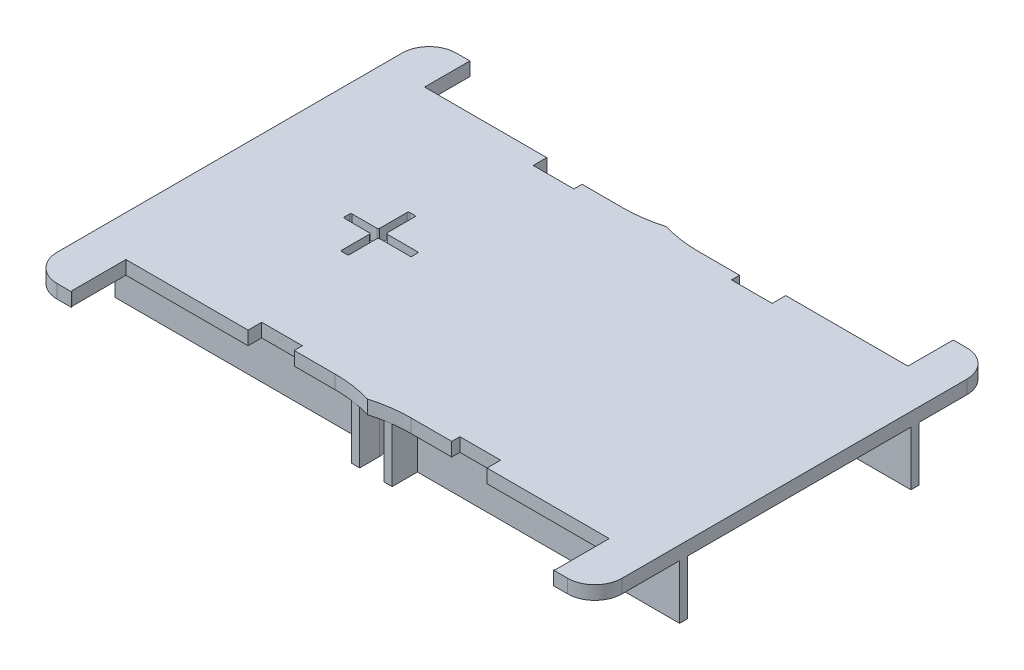
from build123d import *

# Parameters (mm, degrees)
SKETCH1_W            = 208
SKETCH1_H            = 147
BOSS_EXTRUDE1_DEPTH  = 5
CUT_EXTRUDE1_DEPTH   = 129.501744983
SKETCH3_W            = 88.802487793
SKETCH3_H            = 5
CUT_EXTRUDE2_DEPTH   = 5
MIRROR3_COPY_1_DEPTH = 129.501744983
FILLET1_R            = 10
CUT_EXTRUDE3_DEPTH   = 129.501744983
BOSS_EXTRUDE2_DEPTH  = 20
FILLET2_R            = 5
FILLET2_OF_MIRROR4_R = 5
MIRROR5_START        = -20
MIRROR5_DEPTH        = 20


# Read off the part's stored shape, not the designer's step: Mirror5
with BuildPart() as part:
    # Sketch1 → Boss-Extrude1 (new body)
    with BuildSketch(Plane(origin=(0, 0, 0), x_dir=(1, 0, 0), z_dir=(0, 1, 0))):
        with Locations((0, -1.810679612)):
            Rectangle(SKETCH1_W, SKETCH1_H)
    extrude(amount=BOSS_EXTRUDE1_DEPTH)

    # Sketch2 → Cut-Extrude1 (cut, through all)
    with BuildSketch(Plane(origin=(0, 5, 0), x_dir=(1, 0, 0), z_dir=(0, 1, 0))):
        with BuildLine():
            Line((-89, 75), (-89, 55))
            Line((-89, 55), (-44, 55))
            Line((-44, 55), (-44, 50))
            Line((-44, 50), (-29, 50))
            Line((-29, 50), (-29, 53))
            Line((-29, 53), (-14, 53))
            ThreePointArc((-14, 53), (-6.928932188, 53.502525317), (0, 55))
            Line((0, 55), (0, 75))
            Line((0, 75), (-89, 75))
        make_face()
    cut_extrude1 = extrude(amount=-CUT_EXTRUDE1_DEPTH, mode=Mode.SUBTRACT)

    # Mirror1: Cut-Extrude1 across plane
    add(cut_extrude1.mirror(Plane.XY), mode=Mode.SUBTRACT)

    # Sketch3 → Cut-Extrude2 (cut)
    with BuildSketch(Plane.XY.offset(75.310679612)):
        with Locations((-44.401243897, 2.5)):
            Rectangle(SKETCH3_W, SKETCH3_H)
    cut_extrude2 = extrude(amount=-CUT_EXTRUDE2_DEPTH, mode=Mode.SUBTRACT)

    # Mirror3: Cut-Extrude1, Cut-Extrude2 across plane
    add(cut_extrude1.mirror(Plane(origin=(0, 0, 0), x_dir=(0, 0, 1), z_dir=(1, 0, 0))), mode=Mode.SUBTRACT)
    add(cut_extrude2.mirror(Plane(origin=(0, 0, 0), x_dir=(0, 0, 1), z_dir=(1, 0, 0))), mode=Mode.SUBTRACT)

    # Mirror3 copy 1 sketch → Mirror3 copy 1 (cut, through all)
    with BuildSketch(Plane(origin=(0, 5, 0), x_dir=(-1, 0, 0), z_dir=(0, 1, 0))):
        with BuildLine():
            Line((-89, 75), (-89, 55))
            Line((-89, 55), (-44, 55))
            Line((-44, 55), (-44, 50))
            Line((-44, 50), (-29, 50))
            Line((-29, 50), (-29, 53))
            Line((-29, 53), (-14, 53))
            ThreePointArc((-14, 53), (-6.928932188, 53.502525317), (0, 55))
            Line((0, 55), (0, 75))
            Line((0, 75), (-89, 75))
        make_face()
    extrude(amount=-MIRROR3_COPY_1_DEPTH, mode=Mode.SUBTRACT)

    # Fillet1
    fillet1_edges = [part.edges().sort_by_distance(p)[0] for p in [
        (104, 2.5, 75.310679612),
        (-104, 2.5, 75.310679612),
        (-104, 2.5, -71.689320388),
        (104, 2.5, -71.689320388),
    ]]
    fillet(fillet1_edges, radius=FILLET1_R)

    # Sketch4 → Cut-Extrude3 (cut, through all)
    with BuildSketch(Plane(origin=(0, 5, 0), x_dir=(1, 0, 0), z_dir=(0, 1, 0))):
        with BuildLine():
            Line((-52.239573725, -2.137194831), (-52.239573725, -12.224477428))
            ThreePointArc((-52.239573725, -12.224477428), (-52.093127116, -12.578030818), (-51.739573725, -12.724477428))
            Line((-51.739573725, -12.724477428), (-49.914138918, -12.724477428))
            ThreePointArc((-49.914138918, -12.724477428), (-49.560585528, -12.578030818), (-49.414138918, -12.224477428))
            Line((-49.414138918, -12.224477428), (-49.414138918, -2.137194831))
            ThreePointArc((-49.414138918, -2.137194831), (-49.267692309, -1.783641441), (-48.914138918, -1.637194831))
            Line((-48.914138918, -1.637194831), (-37.856129593, -1.637194831))
            ThreePointArc((-37.856129593, -1.637194831), (-37.502576202, -1.490748222), (-37.356129593, -1.137194831))
            Line((-37.356129593, -1.137194831), (-37.356129593, 0.688239976))
            ThreePointArc((-37.356129593, 0.688239976), (-37.502576202, 1.041793366), (-37.856129593, 1.188239976))
            Line((-37.856129593, 1.188239976), (-48.914138918, 1.188239976))
            ThreePointArc((-48.914138918, 1.188239976), (-49.267692309, 1.334686585), (-49.414138918, 1.688239976))
            Line((-49.414138918, 1.688239976), (-49.414138918, 11.775522572))
            ThreePointArc((-49.414138918, 11.775522572), (-49.560585528, 12.129075963), (-49.914138918, 12.275522572))
            Line((-49.914138918, 12.275522572), (-51.739573725, 12.275522572))
            ThreePointArc((-51.739573725, 12.275522572), (-52.093127116, 12.129075963), (-52.239573725, 11.775522572))
            Line((-52.239573725, 11.775522572), (-52.239573725, 1.688239976))
            ThreePointArc((-52.239573725, 1.688239976), (-52.386020335, 1.334686585), (-52.739573725, 1.188239976))
            Line((-52.739573725, 1.188239976), (-61.856129593, 1.188239976))
            ThreePointArc((-61.856129593, 1.188239976), (-62.209682983, 1.041793366), (-62.356129593, 0.688239976))
            Line((-62.356129593, 0.688239976), (-62.356129593, -1.137194831))
            ThreePointArc((-62.356129593, -1.137194831), (-62.209682983, -1.490748222), (-61.856129593, -1.637194831))
            Line((-61.856129593, -1.637194831), (-52.739573725, -1.637194831))
            ThreePointArc((-52.739573725, -1.637194831), (-52.386020335, -1.783641441), (-52.239573725, -2.137194831))
        make_face()
    extrude(amount=-CUT_EXTRUDE3_DEPTH, mode=Mode.SUBTRACT)

    # Sketch5 → Boss-Extrude2 (add)
    with BuildSketch(Plane.XZ):
        Polygon((-104, 44.093533077), (-7.462222255, 44.093533077), (-7.462222255, 53.429268089), (-4.462222255, 53.429268089), (-4.462222255, 41.093533077), (-104, 41.093533077), align=None)
    boss_extrude2 = extrude(amount=BOSS_EXTRUDE2_DEPTH)

    # Fillet2
    fillet2_edges = [part.edges().sort_by_distance(p)[0] for p in [
        (-4.462222255, -10, 41.093533077),
    ]]
    fillet(fillet2_edges, radius=FILLET2_R)

    # Mirror4: Boss-Extrude2 across plane
    add(boss_extrude2.mirror(Plane.XY))

    # Fillet2 of Mirror4
    fillet2_of_mirror4_edges = [part.edges().sort_by_distance(p)[0] for p in [
        (-4.462222255, -10, -41.093533077),
    ]]
    fillet(fillet2_of_mirror4_edges, radius=FILLET2_OF_MIRROR4_R)

    # Mirror5 outline → Mirror5 (add)
    with BuildSketch(Plane(origin=(0, 0, 0), x_dir=(1, 0, 0), z_dir=(0, 1, 0)).offset(MIRROR5_START)):
        with BuildLine():
            Line((104, -44.093533077), (104, -41.093533077))
            Line((104, -41.093533077), (9.462222255, -41.093533077))
            ThreePointArc((9.462222255, -41.093533077), (5.926688349, -42.557999171), (4.462222255, -46.093533077))
            Line((4.462222255, -46.093533077), (4.462222255, -53.429268089))
            Line((4.462222255, -53.429268089), (7.462222255, -53.429268089))
            Line((7.462222255, -53.429268089), (7.462222255, -44.093533077))
            Line((7.462222255, -44.093533077), (104, -44.093533077))
        make_face()
        with BuildLine():
            Line((9.462222255, 41.093533077), (104, 41.093533077))
            Line((104, 41.093533077), (104, 44.093533077))
            Line((104, 44.093533077), (7.462222255, 44.093533077))
            Line((7.462222255, 44.093533077), (7.462222255, 53.429268089))
            Line((7.462222255, 53.429268089), (4.462222255, 53.429268089))
            Line((4.462222255, 53.429268089), (4.462222255, 46.093533077))
            ThreePointArc((4.462222255, 46.093533077), (5.926688349, 42.557999171), (9.462222255, 41.093533077))
        make_face()
    extrude(amount=MIRROR5_DEPTH)


solid = part.part
